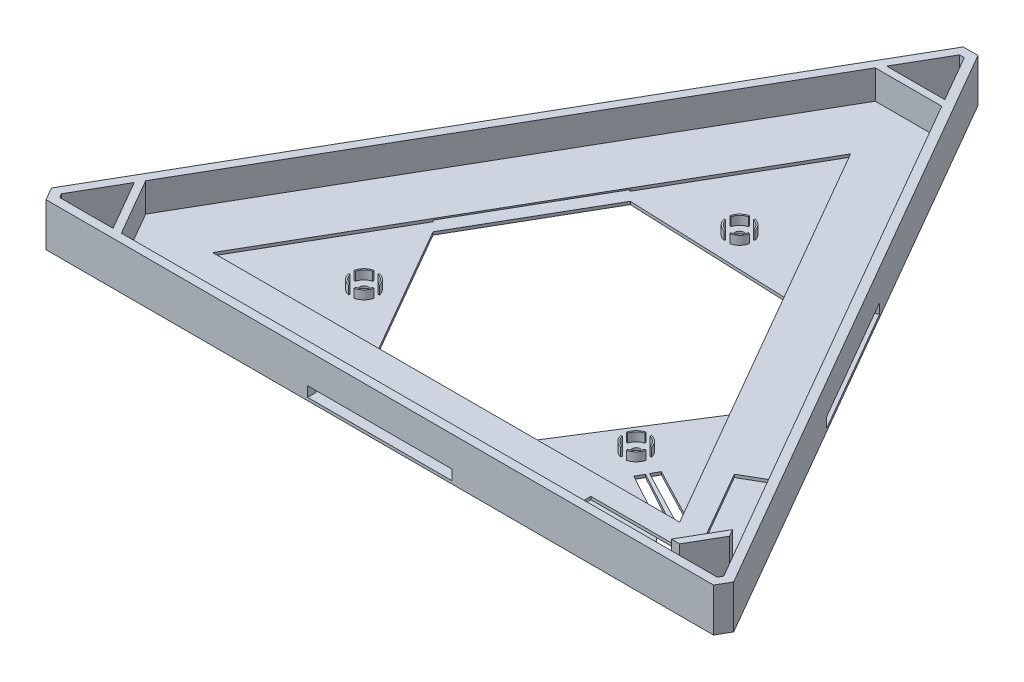
from build123d import *

# Parameters (mm, degrees)
SKETCH1_W                = 34.714871787
SKETCH1_H                = 10.923666426
BOSS_EXTRUDE1_DEPTH      = 1
BOSS_EXTRUDE2_DEPTH      = 11
BOSS_EXTRUDE3_DEPTH      = 5
BOSS_EXTRUDE3_DEPTH_BACK = 3
SKETCH3_W                = 50
SKETCH3_H                = 7
CUT_EXTRUDE3_DEPTH       = 25
SKETCH5_W                = 50
SKETCH5_H                = 7
CUT_EXTRUDE4_DEPTH       = 25
SKETCH6_W                = 50
SKETCH6_H                = 7
CUT_EXTRUDE5_DEPTH       = 25
SKETCH8_R                = 1.5
BOSS_EXTRUDE5_DEPTH      = 1
BOSS_EXTRUDE10_DEPTH     = 3


with BuildPart() as part:
    # Sketch1 → Boss-Extrude1 (new body)
    with BuildSketch(Plane(origin=(0, 0, 0), x_dir=(1, 0, 0), z_dir=(0, 1, 0))):
        Polygon((243.304219775, -116.484791865), (254.809280577, -136.408896137), (442.602090749, -136.409305398), (444.621046679, -132.925433224), (441.749040748, -132.925433224), (449.516726724, -119.471406458), (450.964695298, -121.978953123), (452.699916622, -118.984688018), (358.778179036, 43.666038065), (335.767496284, 43.666038065), align=None)
        with Locations((422.370878913, -129.522754792)):
            Rectangle(SKETCH1_W, SKETCH1_H, mode=Mode.SUBTRACT)
        Polygon((423.190377512, -92.577472767), (432.651287025, -87.114324326), (450.119365975, -117.364996826), (440.658456462, -122.828145267), align=None, mode=Mode.SUBTRACT)
        Polygon((428.113670919, -116.417164681), (266.439108268, -116.428009237), (347.273609729, 23.609230821), align=None, mode=Mode.SUBTRACT)
    extrude(amount=BOSS_EXTRUDE1_DEPTH)

    # Sketch1<9> → Boss-Extrude2 (add)
    # profile 1 of 2: a face of its own
    with BuildSketch(Plane(origin=(0, 0, 0), x_dir=(1, 0, 0), z_dir=(0, 1, 0))):
        Polygon((229.159432548, -134.984249184), (231.716666588, -139.412373829), (462.829865412, -139.412373829), (465.38624875, -134.984588004), (349.829542096, 65.165499075), (344.716133219, 65.165499075), align=None)
        Polygon((251.922647989, -136.409305399), (233.446303401, -136.408896138), (232.62355396, -134.984217357), (241.860901689, -118.984688018), align=None, mode=Mode.SUBTRACT)
        Polygon((442.602090749, -136.409305398), (254.809280577, -136.408896137), (243.304219775, -116.484791865), (335.767496284, 43.666038065), (358.778179036, 43.666038065), (461.938967958, -134.984588006), (461.116393749, -136.409305398), align=None, mode=Mode.SUBTRACT)
        Polygon((348.096628302, 62.164013367), (357.334800991, 46.166038067), (337.210874326, 46.166038067), (346.44844193, 62.165948237), align=None, mode=Mode.SUBTRACT)
    # profile 2 of 2: a face of its own
    with BuildSketch(Plane(origin=(0, 0, 0), x_dir=(1, 0, 0), z_dir=(0, 1, 0))):
        Polygon((441.749040748, -132.925433224), (444.621046679, -132.925433224), (450.964695298, -121.978953123), (449.516726724, -119.471406458), align=None)
    extrude(amount=BOSS_EXTRUDE2_DEPTH)

    # Sketch1<10> → Boss-Extrude3 (add, two sides: drawn at the far end of the back side and taken through both)
    # profile 1 of 2: a face of its own
    with BuildSketch(Plane(origin=(0, 0, 0), x_dir=(1, 0, 0), z_dir=(0, 1, 0)).offset(-BOSS_EXTRUDE3_DEPTH_BACK)):
        Polygon((229.159432548, -134.984249184), (231.716666588, -139.412373829), (462.829865412, -139.412373829), (465.38624875, -134.984588004), (349.829542096, 65.165499075), (344.716133219, 65.165499075), align=None)
        Polygon((251.922647989, -136.409305399), (233.446303401, -136.408896138), (232.62355396, -134.984217357), (241.860901689, -118.984688018), align=None, mode=Mode.SUBTRACT)
        Polygon((442.602090749, -136.409305398), (254.809280577, -136.408896137), (243.304219775, -116.484791865), (335.767496284, 43.666038065), (358.778179036, 43.666038065), (461.938967958, -134.984588006), (461.116393749, -136.409305398), align=None, mode=Mode.SUBTRACT)
        Polygon((348.096628302, 62.164013367), (357.334800991, 46.166038067), (337.210874326, 46.166038067), (346.44844193, 62.165948237), align=None, mode=Mode.SUBTRACT)
    # profile 2 of 2: a face of its own
    with BuildSketch(Plane(origin=(0, 0, 0), x_dir=(1, 0, 0), z_dir=(0, 1, 0)).offset(-BOSS_EXTRUDE3_DEPTH_BACK)):
        Polygon((441.749040748, -132.925433224), (444.621046679, -132.925433224), (450.964695298, -121.978953123), (449.516726724, -119.471406458), align=None)
    extrude(amount=BOSS_EXTRUDE3_DEPTH + BOSS_EXTRUDE3_DEPTH_BACK)

    # Sketch3 → Cut-Extrude3 (cut)
    with BuildSketch(Plane(origin=(290.589645397, 0, -167.772009994), x_dir=(-0.49999999999998745, 0, -0.8660254037844459), z_dir=(0.8660254037844459, 0, -0.49999999999998745))):
        with Locations((-236.592990632, -3)):
            Rectangle(SKETCH3_W, SKETCH3_H)
    extrude(amount=-CUT_EXTRUDE3_DEPTH, mode=Mode.SUBTRACT)

    # Sketch5 → Cut-Extrude4 (cut)
    with BuildSketch(Plane.XY.offset(139.412373829)):
        with Locations((347.273266, -3)):
            Rectangle(SKETCH5_W, SKETCH5_H)
    extrude(amount=-CUT_EXTRUDE4_DEPTH, mode=Mode.SUBTRACT)

    # Sketch6 → Cut-Extrude5 (cut)
    with BuildSketch(Plane(origin=(230.319375798, 0, 132.975171837), x_dir=(-0.5000006154012504, 0, 0.8660250484820695), z_dir=(-0.8660250484820695, 0, -0.5000006154012504))):
        with Locations((-113.236674799, -3)):
            Rectangle(SKETCH6_W, SKETCH6_H)
    extrude(amount=-CUT_EXTRUDE5_DEPTH, mode=Mode.SUBTRACT)

    # Sketch8 → Boss-Extrude5 (add)
    with BuildSketch(Plane.XZ.offset(3)):
        Polygon((349.829542096, -65.165499075), (465.38624875, 134.984588004), (462.829865412, 139.412373829), (231.716666588, 139.412373829), (229.159432548, 134.984249184), (344.716133219, -65.165499075), align=None)
        with Locations((395.323540807, 98.692824234)):
            Circle(SKETCH8_R, mode=Mode.SUBTRACT)
        with Locations((348.301285091, 15.863526629)):
            Circle(SKETCH8_R, mode=Mode.SUBTRACT)
        with Locations((299.654911442, 97.24168178)):
            Circle(SKETCH8_R, mode=Mode.SUBTRACT)
        Polygon((444.621046679, 132.925433224), (450.964695298, 121.978953123), (449.516726724, 119.471406458), (427.347592194, 115.090208207), (404.33298615, 103.060878104), (405.774939109, 100.430142149), (424.549299543, 110.243170393), (451.871255231, 117.549638152), (452.699916622, 118.984688018), (461.938967958, 134.984588006), (461.116393749, 136.409305398), (442.602090749, 136.409305398), (439.019602541, 136.409297591), (420.379437571, 116.417683466), (402.410382205, 106.568526044), (403.852335164, 103.937790089), (426.620208946, 116.417264857), (441.749040748, 132.925433224), align=None, mode=Mode.SUBTRACT)
        Polygon((322.273266, 116.42426408), (294.358218631, 68.061097964), (319.354499367, 24.757680453), (376.473657316, 26.969372806), (401.47267951, 70.271207531), (372.273266, 116.420910257), align=None, mode=Mode.SUBTRACT)
        Polygon((233.446303401, 136.408896138), (251.922647989, 136.409305399), (241.860901689, 118.984688018), (232.62355396, 134.984217357), align=None, mode=Mode.SUBTRACT)
        Polygon((337.210874326, -46.166038067), (357.334800991, -46.166038067), (348.096628302, -62.164013367), (346.44844193, -62.165948237), align=None, mode=Mode.SUBTRACT)
    extrude(amount=BOSS_EXTRUDE5_DEPTH)

    # Sketch12 → Boss-Extrude10 (add)
    with BuildSketch(Plane(origin=(0, -3, 0), x_dir=(1, 0, 0), z_dir=(0, 1, 0))):
        with BuildLine():
            ThreePointArc((352.690173981, -14.869718639), (351.483265607, -12.681546114), (349.295093082, -11.47463774))
            Line((349.295093081, -11.47463774), (349.184669971, -11.962292061))
            ThreePointArc((349.184669972, -11.962292061), (351.129712216, -13.035099504), (352.20251966, -14.980141749))
            Line((352.202519659, -14.980141749), (352.69017398, -14.869718639))
        make_face()
        with BuildLine():
            Line((347.417900211, -11.962292061), (347.307477101, -11.47463774))
            ThreePointArc((347.307477101, -11.47463774), (345.119304576, -12.681546114), (343.912396202, -14.869718639))
            Line((343.912396203, -14.869718639), (344.400050524, -14.980141749))
            ThreePointArc((344.400050523, -14.980141749), (345.472857967, -13.035099504), (347.417900211, -11.962292061))
        make_face()
        with BuildLine():
            ThreePointArc((349.295093082, -20.252415518), (351.483265607, -19.045507145), (352.690173981, -16.857334619))
            Line((352.69017398, -16.857334619), (352.202519659, -16.746911509))
            ThreePointArc((352.20251966, -16.746911509), (351.129712216, -18.691953754), (349.184669972, -19.764761197))
            Line((349.184669971, -19.764761197), (349.295093081, -20.252415518))
        make_face()
        with BuildLine():
            Line((344.400050524, -16.746911509), (343.912396203, -16.857334619))
            ThreePointArc((343.912396202, -16.857334619), (345.119304576, -19.045507145), (347.307477101, -20.252415518))
            Line((347.307477101, -20.252415518), (347.417900211, -19.764761197))
            ThreePointArc((347.417900211, -19.764761197), (345.472857967, -18.691953754), (344.400050523, -16.746911509))
        make_face()
        with BuildLine():
            Line((394.440155927, -94.791589666), (394.329732817, -94.303935345))
            ThreePointArc((394.329732817, -94.303935345), (392.141560292, -95.510843718), (390.934651918, -97.699016244))
            Line((390.934651918, -97.699016244), (391.4247896, -97.798542945))
            ThreePointArc((391.4247896, -97.798542945), (392.499067689, -95.860448622), (394.440155927, -94.791589666))
        make_face()
        with BuildLine():
            ThreePointArc((399.712429696, -97.699016244), (398.505521323, -95.510843718), (396.317348797, -94.303935345))
            Line((396.317348797, -94.303935345), (396.206925687, -94.791589666))
            ThreePointArc((396.206925687, -94.791589666), (398.151967932, -95.864397109), (399.224775375, -97.809439354))
            Line((399.224775375, -97.809439354), (399.712429696, -97.699016244))
        make_face()
        with BuildLine():
            Line((391.422306239, -99.576209114), (390.934651918, -99.686632224))
            ThreePointArc((390.934651918, -99.686632224), (392.141560292, -101.874804749), (394.329732817, -103.081713123))
            Line((394.329732817, -103.081713122), (394.440155927, -102.594058801))
            ThreePointArc((394.440155927, -102.594058802), (392.495113682, -101.521251358), (391.422306239, -99.576209114))
        make_face()
        with BuildLine():
            ThreePointArc((396.317348797, -103.081713123), (398.505521323, -101.874804749), (399.712429696, -99.686632224))
            Line((399.712429696, -99.686632224), (399.224775375, -99.576209114))
            ThreePointArc((399.224775375, -99.576209114), (398.151967932, -101.521251358), (396.206925687, -102.594058802))
            Line((396.206925687, -102.594058801), (396.317348797, -103.081713122))
        make_face()
        with BuildLine():
            ThreePointArc((298.661103452, -92.852792892), (296.472930927, -94.059701265), (295.266022553, -96.24787379))
            Line((295.266022553, -96.24787379), (295.753676874, -96.3582969))
            ThreePointArc((295.753676874, -96.3582969), (296.826484317, -94.413254656), (298.771526562, -93.340447213))
            Line((298.771526562, -93.340447212), (298.661103452, -92.852792891))
        make_face()
        with BuildLine():
            Line((295.753676874, -98.12506666), (295.266022553, -98.23548977))
            ThreePointArc((295.266022553, -98.23548977), (296.472930927, -100.423662295), (298.661103452, -101.630570669))
            Line((298.661103452, -101.630570669), (298.771526562, -101.142916348))
            ThreePointArc((298.771526562, -101.142916348), (296.826484317, -100.070108905), (295.753676874, -98.12506666))
        make_face()
        with BuildLine():
            ThreePointArc((304.04380033, -96.24787379), (302.836891957, -94.059701265), (300.648719432, -92.852792892))
            Line((300.648719432, -92.852792891), (300.538296322, -93.340447212))
            ThreePointArc((300.538296322, -93.340447213), (302.483338566, -94.413254656), (303.55614601, -96.3582969))
            Line((303.55614601, -96.3582969), (304.043800331, -96.24787379))
        make_face()
        with BuildLine():
            Line((300.538296322, -101.142916348), (300.648719432, -101.630570669))
            ThreePointArc((300.648719432, -101.630570669), (302.836891957, -100.423662295), (304.04380033, -98.23548977))
            Line((304.043800331, -98.23548977), (303.55614601, -98.12506666))
            ThreePointArc((303.55614601, -98.12506666), (302.483338566, -100.070108905), (300.538296322, -101.142916348))
        make_face()
    extrude(amount=BOSS_EXTRUDE10_DEPTH)


solid = part.part
